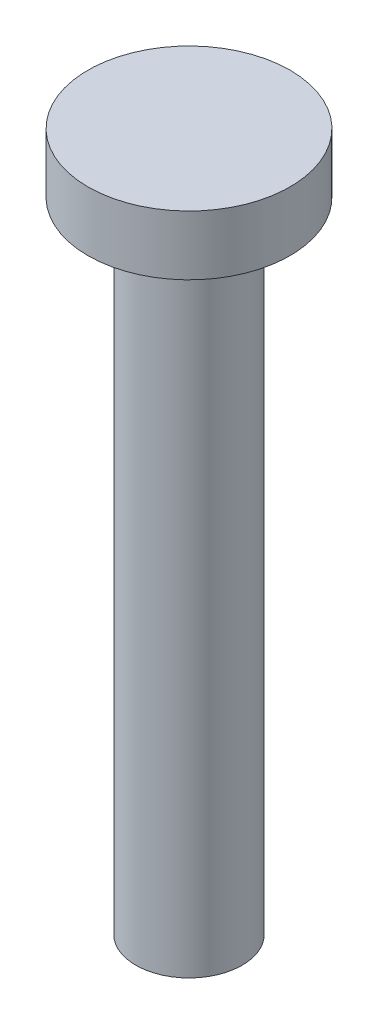
from build123d import *


with BuildPart() as part:
    # Sketch1 → Revolve1 (revolve)
    with BuildSketch(Plane.XY):
        Polygon((0, -30), (2.5, -30), (2.5, 0), (4.75, 0), (4.75, 2.8), (0, 2.8), align=None)
    revolve(axis=Axis((0, -10, 0), (0, 1, 0)))


solid = part.part
